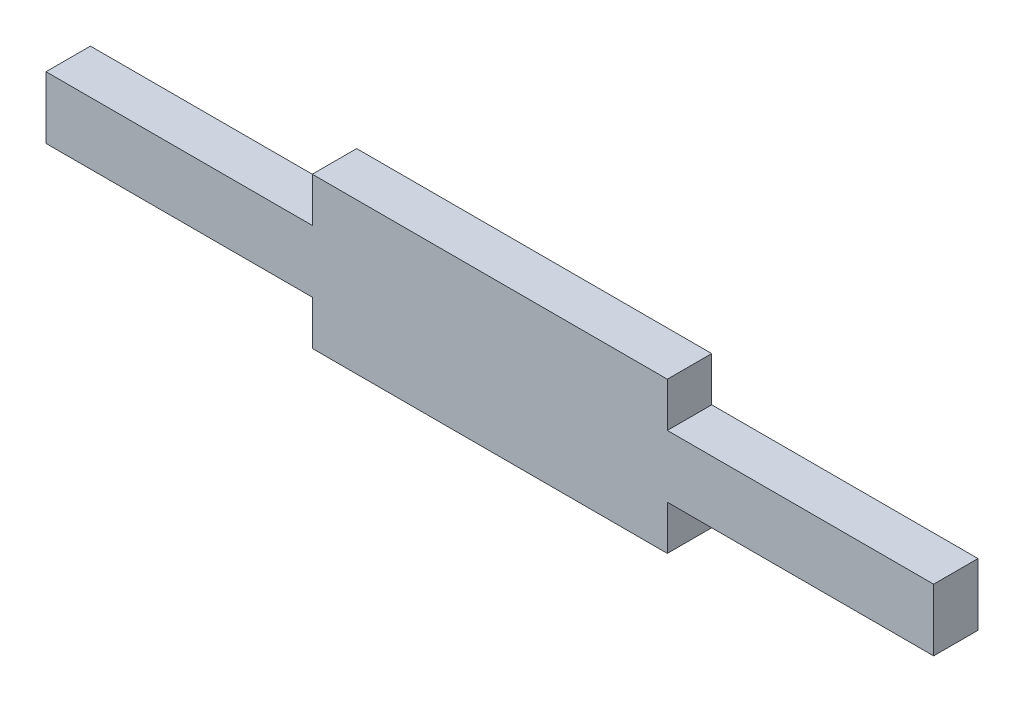
from build123d import *

# Parameters (mm, degrees)
SKIZZE1_W                       = 100
SKIZZE1_H                       = 7
AUFSATZ_LINEAR_AUSTRAGEN1_DEPTH = 5
SKIZZE2_W                       = 40
SKIZZE2_H                       = 5
AUFSATZ_LINEAR_AUSTRAGEN3_DEPTH = 5


with BuildPart() as part:
    # Skizze1 → Aufsatz-Linear austragen1 (new body)
    with BuildSketch(Plane.XY):
        with Locations((50, -3.5)):
            Rectangle(SKIZZE1_W, SKIZZE1_H)
    extrude(amount=AUFSATZ_LINEAR_AUSTRAGEN1_DEPTH)

    # Skizze2 → Aufsatz-Linear austragen3 (add)
    with BuildSketch(Plane(origin=(0, 0, 0), x_dir=(1, 0, 0), z_dir=(0, 1, 0))):
        with Locations((50, -2.5)):
            Rectangle(SKIZZE2_W, SKIZZE2_H)
    aufsatz_linear_austragen3 = extrude(amount=AUFSATZ_LINEAR_AUSTRAGEN3_DEPTH)

    # Spiegeln1: Aufsatz-Linear austragen3 across plane
    add(aufsatz_linear_austragen3.mirror(Plane.ZX.offset(-3.5)))


solid = part.part
